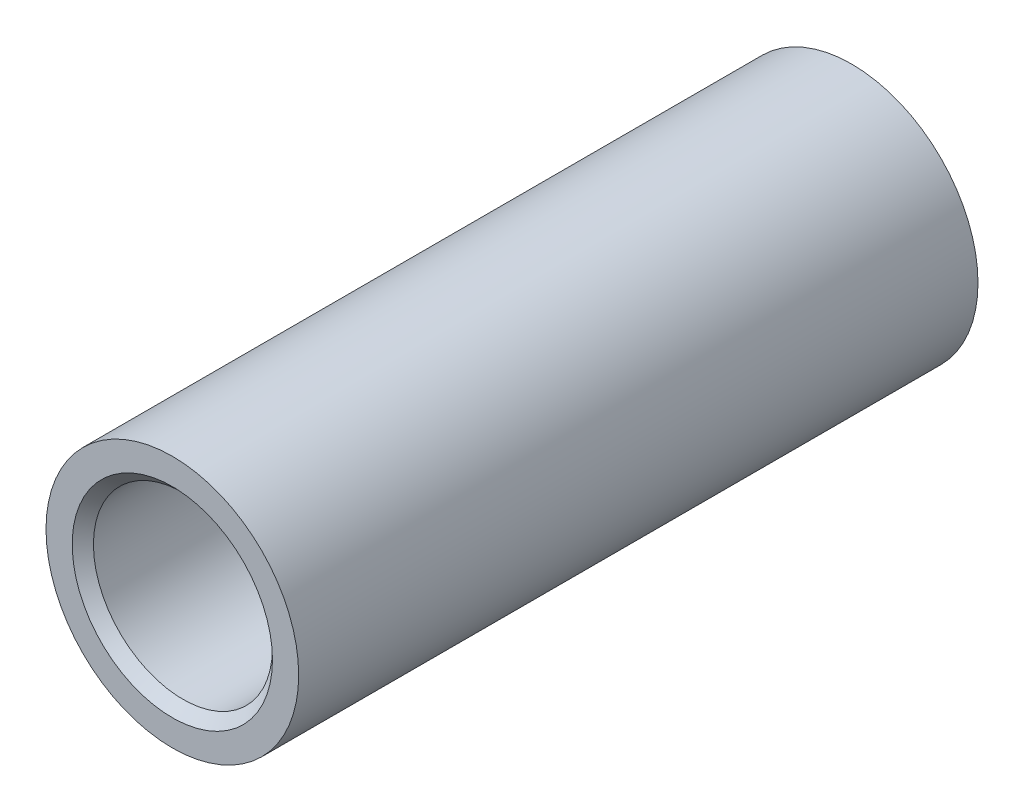
from build123d import *

# Parameters (mm, degrees)
SKETCH1_R           = 4.7625
SKETCH1_R_2         = 3.375
BOSS_EXTRUDE1_DEPTH = 25.608000038
CHAMFER1_SIZE       = 0.4


with BuildPart() as part:
    # Sketch1 → Boss-Extrude1 (new body)
    with BuildSketch(Plane.XY):
        Circle(SKETCH1_R)
        Circle(SKETCH1_R_2, mode=Mode.SUBTRACT)
    extrude(amount=BOSS_EXTRUDE1_DEPTH)

    # Chamfer1
    chamfer1_edges = [part.edges().sort_by_distance(p)[0] for p in [
        (-3.375, 0, 0),
        (-3.375, 0, 25.608000038),
    ]]
    chamfer(chamfer1_edges, length=CHAMFER1_SIZE)


solid = part.part
